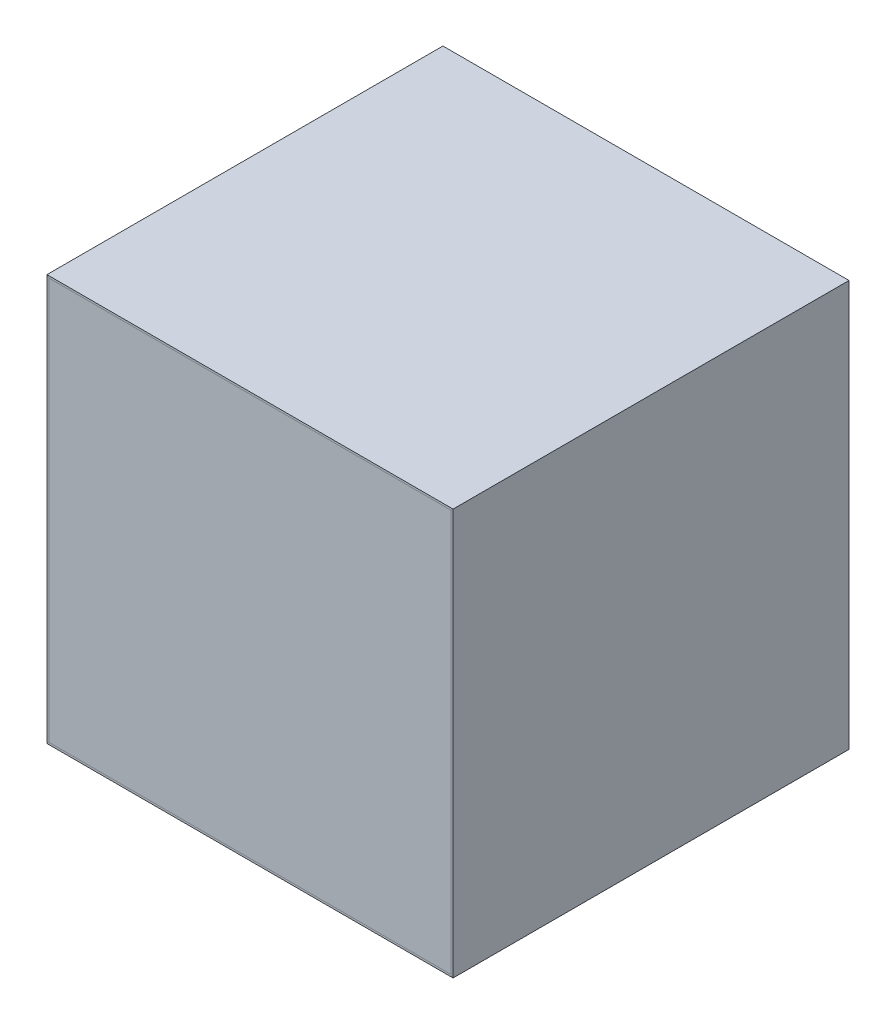
from build123d import *

# Parameters (mm, degrees)
SKETCH3_W           = 1000
SKETCH3_H           = 1000
SKETCH3_W_2         = 990
SKETCH3_H_2         = 990
EXTRUDE_THIN1_DEPTH = 975
SKETCH4_W           = 990
SKETCH4_H           = 990
BOSS_EXTRUDE1_DEPTH = 5
SPLIT2_START        = 25
SPLIT2_DEPTH        = 975
SPLIT2_START_2      = -282.90665875
SPLIT2_2_OUTLINE_W  = 708.611311157
SPLIT2_2_OUTLINE_H  = 978
SPLIT2_2_DEPTH      = 1414.199703204
SPLIT2_START_3      = 424.226289007
SPLIT2_3_OUTLINE_W  = 708.388688843
SPLIT2_3_OUTLINE_H  = 978
SPLIT2_3_DEPTH      = 707.066755447
SPLIT2_4_DEPTH      = 975
SPLIT2_5_DEPTH      = 975


# Read off the part's stored shape, not the designer's step: Split2
with BuildPart() as part:
    # Sketch3 → Extrude-Thin1 (new body)
    with BuildSketch(Plane(origin=(0, 0, 1000), x_dir=(-1, 0, 0), z_dir=(0, 0, -1))):
        with Locations((-599.493213862, 0.396752623)):
            Rectangle(SKETCH3_W, SKETCH3_H)
        with Locations((-599.493213862, 0.396752623)):
            Rectangle(SKETCH3_W_2, SKETCH3_H_2, mode=Mode.SUBTRACT)
    extrude(amount=EXTRUDE_THIN1_DEPTH)

    # Split2 2 outline → Split2 2 (cut)
    with BuildSketch(Plane(origin=(0, 0, 0), x_dir=(0.7071067811865471, -0.707106781186548, 0), z_dir=(0.707106781186548, 0.707106781186547, 0)).offset(SPLIT2_START_2)):
        with Locations((69.305655579, -513)):
            Rectangle(SPLIT2_2_OUTLINE_W, SPLIT2_2_OUTLINE_H)
    extrude(amount=SPLIT2_2_DEPTH, mode=Mode.SUBTRACT)

    # Split2 3 outline → Split2 3 (cut)
    with BuildSketch(Plane(origin=(0, 0, 0), x_dir=(0.7071067811865471, -0.707106781186548, 0), z_dir=(0.707106781186548, 0.707106781186547, 0)).offset(SPLIT2_START_3)):
        with Locations((777.805655579, -513)):
            Rectangle(SPLIT2_3_OUTLINE_W, SPLIT2_3_OUTLINE_H)
    extrude(amount=SPLIT2_3_DEPTH, mode=Mode.SUBTRACT)


with BuildPart() as body_2:
    # Sketch4 → Boss-Extrude1 (new body)
    with BuildSketch(Plane(origin=(0, 0, 1000), x_dir=(-1, 0, 0), z_dir=(0, 0, -1))):
        with Locations((-599.493213862, 0.396752623)):
            Rectangle(SKETCH4_W, SKETCH4_H)
    extrude(amount=BOSS_EXTRUDE1_DEPTH)


with BuildPart() as body_3:
    # Split2 outline → Split2 (new body)
    with BuildSketch(Plane.XY.offset(SPLIT2_START)):
        Polygon((104.549818806, 495.396752623), (1094.473614036, 495.396752623), (1099.473614036, 500.396752623), (99.549818806, 500.396752623), align=None)
    extrude(amount=SPLIT2_DEPTH)


with BuildPart() as body_4:
    # Split2 4 outline → Split2 4 (new body)
    with BuildSketch(Plane.XY.offset(SPLIT2_START)):
        Polygon((1099.473614036, 500.396752623), (1094.473614036, 495.396752623), (1094.493213862, 495.396752623), (1094.493213862, -494.546642432), (1099.493213862, -499.546642432), (1099.493213862, 500.396752623), align=None)
    extrude(amount=SPLIT2_4_DEPTH)


with BuildPart() as body_5:
    # Split2 5 outline → Split2 5 (new body)
    with BuildSketch(Plane.XY.offset(SPLIT2_START)):
        Polygon((104.549818806, 495.396752623), (99.549818806, 500.396752623), (99.493213862, 500.396752623), (99.493213862, -499.583647551), (104.493213862, -494.583647551), (104.493213862, 495.396752623), align=None)
    extrude(amount=SPLIT2_5_DEPTH)


solid = Compound([part.part, body_2.part, body_3.part, body_4.part, body_5.part])
